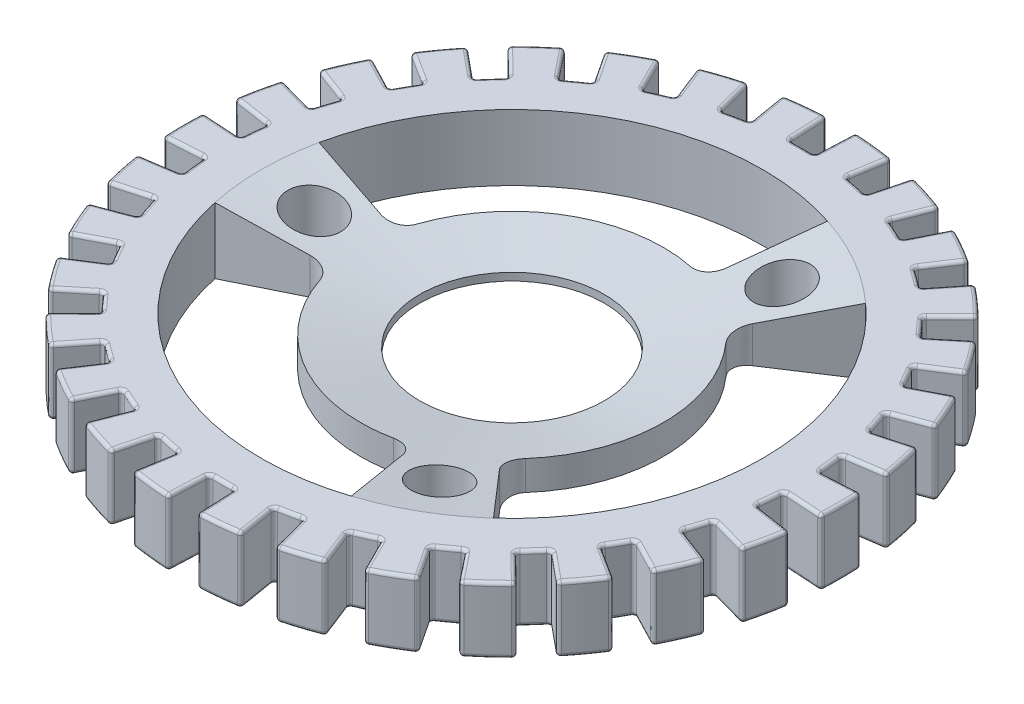
from build123d import *

# Parameters (mm, degrees)
SKETCH_1_W                       = 50
SKETCH_1_H                       = 10
SKETCH_2_W                       = 14
SKETCH_2_H                       = 10
CUT_REVOLVE_START                = -5
CUT_REVOLVE_2_DEPTH              = 10
PATTERN_CIRCULAR_1_COUNT         = 3
CUT_REVOLVE_3_DEPTH              = 10
FILLET_1_R                       = 0.5
PATTERN_CIRCULAR_2_COUNT         = 30
FILLET_1_OF_PATTERN_CIRCULAR_2_R = 0.5
FILLET_2_R                       = 0.5
SKETCH_7_W                       = 4
SKETCH_7_H                       = 20
PATTERN_CIRCULAR_3_COUNT         = 18
FILLET_5_R                       = 3


# Read off the part's stored shape, not the designer's step: Вырез-Повернуть2, Вырез-Повернуть3
with BuildPart() as part:
    # Эскиз1 → Повернуть1 (revolve)
    with BuildSketch(Plane.XY, mode=Mode.PRIVATE) as revolve_1_sk:
        with Locations((25, 0)):
            Rectangle(SKETCH_1_W, SKETCH_1_H)
    revolve(revolve_1_sk.sketch.rotate(Axis((0, -5, 0), (0, 1, 0)), 90), axis=Axis((0, -5, 0), (0, 1, 0)))

    # Эскиз2 → Вырез-Повернуть1 (revolve, cut)
    with BuildSketch(Plane.XY, mode=Mode.PRIVATE) as cut_revolve_1_sk:
        with Locations((7, 0)):
            Rectangle(SKETCH_2_W, SKETCH_2_H)
    revolve(cut_revolve_1_sk.sketch.rotate(Axis((0, 5, 0), (0, -1, 0)), 90), axis=Axis((0, 5, 0), (0, -1, 0)), mode=Mode.SUBTRACT)

    # Вырез-Повернуть2 outline → Вырез-Повернуть2 (cut)
    with BuildSketch(Plane(origin=(0, 0, 0), x_dir=(1, 0, 0), z_dir=(0, 1, 0)).offset(CUT_REVOLVE_START)):
        with BuildLine():
            ThreePointArc((15.390003946, 17.092330986), (23, 0), (15.390003946, -17.092330986))
            Line((15.390003946, -17.092330986), (25.426963042, -28.239503368))
            ThreePointArc((25.426963042, -28.239503368), (38, 0), (25.426963042, 28.239503368))
            Line((25.426963042, 28.239503368), (15.390003946, 17.092330986))
        make_face()
    cut_revolve_2 = extrude(amount=CUT_REVOLVE_2_DEPTH, mode=Mode.SUBTRACT)

    # Круговой массив1: Вырез-Повернуть2 ×3 about axis
    pattern_circular_1_axis = Axis((0, 0, 0), (0, 1, 0))
    for i in range(1, PATTERN_CIRCULAR_1_COUNT):
        add(cut_revolve_2.rotate(pattern_circular_1_axis, i * 360 / PATTERN_CIRCULAR_1_COUNT), mode=Mode.SUBTRACT)

    # Вырез-Повернуть3 outline → Вырез-Повернуть3 (cut)
    with BuildSketch(Plane(origin=(0, 0, 0), x_dir=(1, 0, 0), z_dir=(0, 1, 0)).offset(CUT_REVOLVE_START)):
        with BuildLine():
            ThreePointArc((-1.919253044, 43.95812175), (0, 44), (1.919253044, 43.95812175))
            Line((1.919253044, 43.95812175), (2.180969368, 49.952411079))
            ThreePointArc((2.180969368, 49.952411079), (0, 50), (-2.180969368, 49.952411079))
            Line((-2.180969368, 49.952411079), (-1.919253044, 43.95812175))
        make_face()
    cut_revolve_3 = extrude(amount=CUT_REVOLVE_3_DEPTH, mode=Mode.SUBTRACT)

    # Скругление1
    fillet_1_edges = [part.edges().sort_by_distance(p)[0] for p in [
        (-2.180969368, 0, -49.952411079),
        (-1.919253044, 0, -43.95812175),
        (2.180969368, 0, -49.952411079),
        (1.919253044, 0, -43.95812175),
    ]]
    fillet(fillet_1_edges, radius=FILLET_1_R)

    # Круговой массив2: Вырез-Повернуть3 ×30 about axis
    pattern_circular_2_axis = Axis((0, 0, 0), (0, 1, 0))
    for i in range(1, PATTERN_CIRCULAR_2_COUNT):
        add(cut_revolve_3.rotate(pattern_circular_2_axis, i * 360 / PATTERN_CIRCULAR_2_COUNT), mode=Mode.SUBTRACT)

    # Скругление1 of Круговой массив2
    fillet_1_of_pattern_circular_2_edges = [part.edges().sort_by_distance(p)[0] for p in [
        (-12.519000202, 0, -48.407382019),
        (-11.016720178, 0, -42.598496177),
        (-8.252380293, 0, -49.314280077),
        (-7.262094658, 0, -43.396566468),
        (-22.309890655, 0, -44.74671808),
        (-19.632703777, 0, -39.377111911),
        (-18.325061336, 0, -46.520878399),
        (-16.126053976, 0, -40.938372992),
        (-31.125731832, 0, -39.130407843),
        (-27.390644012, 0, -34.434758902),
        (-27.596849266, 0, -41.694291103),
        (-24.285227354, 0, -36.690976171),
        (-38.581229169, 0, -31.803911014),
        (-33.951481669, 0, -27.987441693),
        (-35.662522458, 0, -35.045463215),
        (-31.383019763, 0, -30.840007629),
        (-44.350541659, 0, -23.087430662),
        (-39.02847666, 0, -20.316938983),
        (-42.169572291, 0, -26.864980417),
        (-37.109223616, 0, -23.641182767),
        (-48.18152266, 0, -13.361918804),
        (-42.399739942, 0, -11.758488548),
        (-46.833609462, 0, -17.510369063),
        (-41.213576327, 0, -15.409124775),
        (-49.906739921, 0, -3.052426977),
        (-43.917931131, 0, -2.68613574),
        (-49.450793168, 0, -7.390470556),
        (-43.516697988, 0, -6.50361409),
        (-49.450793168, 0, 7.390470556),
        (-43.516697988, 0, 6.50361409),
        (-49.906739921, 0, 3.052426977),
        (-43.917931131, 0, 2.68613574),
        (-46.833609462, 0, 17.510369063),
        (-41.213576327, 0, 15.409124775),
        (-48.18152266, 0, 13.361918804),
        (-42.399739942, 0, 11.758488548),
        (-42.169572291, 0, 26.864980417),
        (-37.109223616, 0, 23.641182767),
        (-44.350541659, 0, 23.087430662),
        (-39.02847666, 0, 20.316938983),
        (-35.662522458, 0, 35.045463215),
        (-31.383019763, 0, 30.840007629),
        (-38.581229169, 0, 31.803911014),
        (-33.951481669, 0, 27.987441693),
        (-27.596849266, 0, 41.694291103),
        (-24.285227354, 0, 36.690976171),
        (-31.125731832, 0, 39.130407843),
        (-27.390644012, 0, 34.434758902),
        (-18.325061336, 0, 46.520878399),
        (-16.126053976, 0, 40.938372992),
        (-22.309890655, 0, 44.74671808),
        (-19.632703777, 0, 39.377111911),
        (-8.252380293, 0, 49.314280077),
        (-7.262094658, 0, 43.396566468),
        (-12.519000202, 0, 48.407382019),
        (-11.016720178, 0, 42.598496177),
        (2.180969368, 0, 49.952411079),
        (1.919253044, 0, 43.95812175),
        (-2.180969368, 0, 49.952411079),
        (-1.919253044, 0, 43.95812175),
        (12.519000202, 0, 48.407382019),
        (11.016720178, 0, 42.598496177),
        (8.252380293, 0, 49.314280077),
        (7.262094658, 0, 43.396566468),
        (22.309890655, 0, 44.74671808),
        (19.632703777, 0, 39.377111911),
        (18.325061336, 0, 46.520878399),
        (16.126053976, 0, 40.938372992),
        (31.125731832, 0, 39.130407843),
        (27.390644012, 0, 34.434758902),
        (27.596849266, 0, 41.694291103),
        (24.285227354, 0, 36.690976171),
        (38.581229169, 0, 31.803911014),
        (33.951481669, 0, 27.987441693),
        (35.662522458, 0, 35.045463215),
        (31.383019763, 0, 30.840007629),
        (44.350541659, 0, 23.087430662),
        (39.02847666, 0, 20.316938983),
        (42.169572291, 0, 26.864980417),
        (37.109223616, 0, 23.641182767),
        (48.18152266, 0, 13.361918804),
        (42.399739942, 0, 11.758488548),
        (46.833609462, 0, 17.510369063),
        (41.213576327, 0, 15.409124775),
        (49.906739921, 0, 3.052426977),
        (43.917931131, 0, 2.68613574),
        (49.450793168, 0, 7.390470556),
        (43.516697988, 0, 6.50361409),
        (49.450793168, 0, -7.390470556),
        (43.516697988, 0, -6.50361409),
        (49.906739921, 0, -3.052426977),
        (43.917931131, 0, -2.68613574),
        (46.833609462, 0, -17.510369063),
        (41.213576327, 0, -15.409124775),
        (48.18152266, 0, -13.361918804),
        (42.399739942, 0, -11.758488548),
        (42.169572291, 0, -26.864980417),
        (37.109223616, 0, -23.641182767),
        (44.350541659, 0, -23.087430662),
        (39.02847666, 0, -20.316938983),
        (35.662522458, 0, -35.045463215),
        (31.383019763, 0, -30.840007629),
        (38.581229169, 0, -31.803911014),
        (33.951481669, 0, -27.987441693),
        (27.596849266, 0, -41.694291103),
        (24.285227354, 0, -36.690976171),
        (31.125731832, 0, -39.130407843),
        (27.390644012, 0, -34.434758902),
        (18.325061336, 0, -46.520878399),
        (16.126053976, 0, -40.938372992),
        (22.309890655, 0, -44.74671808),
        (19.632703777, 0, -39.377111911),
        (8.252380293, 0, -49.314280077),
        (7.262094658, 0, -43.396566468),
        (12.519000202, 0, -48.407382019),
        (11.016720178, 0, -42.598496177),
    ]]
    fillet(fillet_1_of_pattern_circular_2_edges, radius=FILLET_1_OF_PATTERN_CIRCULAR_2_R)

    # Скругление2
    fillet_2_edges = [part.edges().sort_by_distance(p)[0] for p in [
        (-46.481107678, -5, -6.946648086),
        (-46.481107678, 5, -6.946648086),
        (-46.909673304, 5, -2.86911853),
        (-46.909673304, -5, -2.86911853),
        (-48.907380037, -5, -10.395584541),
        (-48.907380037, 5, -10.395584541),
        (-43.682081193, -5, -6.382260416),
        (-43.682081193, 5, -6.382260416),
        (-44.054469468, -5, -2.839222646),
        (-44.054469468, 5, -2.839222646),
        (-41.846486717, 5, -13.596747752),
        (-41.846486717, -5, -13.596747752),
        (-44.021094605, -5, -16.458812847),
        (-44.021094605, 5, -16.458812847),
        (-45.288061108, 5, -12.559490898),
        (-45.288061108, -5, -12.559490898),
        (-45.677272882, -5, -20.336832154),
        (-45.677272882, 5, -20.336832154),
        (-41.40057636, -5, -15.324808072),
        (-41.40057636, 5, -15.324808072),
        (-42.501466031, -5, -11.936618055),
        (-42.501466031, 5, -11.936618055),
        (-38.105117767, 5, -22),
        (-38.105117767, -5, -22),
        (-39.637148462, -5, -25.251648508),
        (-39.637148462, 5, -25.251648508),
        (-41.687143327, 5, -21.700953248),
        (-41.687143327, -5, -21.700953248),
        (-40.450849719, -5, -29.389262615),
        (-40.450849719, 5, -29.389262615),
        (-37.309667677, -5, -23.597588079),
        (-37.309667677, 5, -23.597588079),
        (-39.090944583, -5, -20.512325976),
        (-39.090944583, 5, -20.512325976),
        (-32.698372321, 5, -29.44174668),
        (-32.698372321, -5, -29.44174668),
        (-33.520868731, -5, -32.940865959),
        (-33.520868731, 5, -32.940865959),
        (-36.264297344, 5, -29.893979807),
        (-36.264297344, -5, -29.893979807),
        (-33.456530318, -5, -37.157241274),
        (-33.456530318, 5, -37.157241274),
        (-31.588147486, -5, -30.839040254),
        (-31.588147486, 5, -30.839040254),
        (-33.971961278, -5, -28.191546823),
        (-33.971961278, 5, -28.191546823),
        (-25.862551101, 5, -35.596747752),
        (-25.862551101, -5, -35.596747752),
        (-25.939566185, -5, -39.190409499),
        (-25.939566185, 5, -39.190409499),
        (-29.256527553, 5, -36.780496002),
        (-29.256527553, -5, -36.780496002),
        (-25, -5, -43.301270189),
        (-25, 5, -43.301270189),
        (-24.486073673, -5, -36.732678387),
        (-24.486073673, 5, -36.732678387),
        (-27.36824025, -5, -34.638661795),
        (-27.36824025, 5, -34.638661795),
        (-17.896412295, 5, -40.196000136),
        (-17.896412295, -5, -40.196000136),
        (-17.224580125, -5, -43.727144088),
        (-17.224580125, 5, -43.727144088),
        (-20.970107119, 5, -42.059528029),
        (-20.970107119, -5, -42.059528029),
        (-15.450849719, -5, -47.552825815),
        (-15.450849719, 5, -47.552825815),
        (-16.313840943, -5, -41.020922211),
        (-16.313840943, 5, -41.020922211),
        (-19.568395795, -5, -39.571901033),
        (-19.568395795, 5, -39.571901033),
        (-9.148114396, 5, -43.038494432),
        (-9.148114396, -5, -43.038494432),
        (-7.756797261, -5, -46.352792654),
        (-7.756797261, 5, -46.352792654),
        (-11.767192378, 5, -45.500356857),
        (-11.767192378, -5, -45.500356857),
        (-5.226423163, -5, -49.726094768),
        (-5.226423163, 5, -49.726094768),
        (-7.428615081, -5, -43.516354895),
        (-7.428615081, 5, -43.516354895),
        (-10.913318545, -5, -42.775658308),
        (-10.913318545, 5, -42.775658308),
        (9.148114396, 5, -43.038494432),
        (9.148114396, -5, -43.038494432),
        (11.767192378, -5, -45.500356857),
        (11.767192378, 5, -45.500356857),
        (7.756797261, 5, -46.352792654),
        (7.756797261, -5, -46.352792654),
        (15.450849719, -5, -47.552825815),
        (15.450849719, 5, -47.552825815),
        (10.913318545, -5, -42.775658308),
        (10.913318545, 5, -42.775658308),
        (7.428615081, -5, -43.516354895),
        (7.428615081, 5, -43.516354895),
        (17.896412295, 5, -40.196000136),
        (17.896412295, -5, -40.196000136),
        (20.970107119, -5, -42.059528029),
        (20.970107119, 5, -42.059528029),
        (17.224580125, 5, -43.727144088),
        (17.224580125, -5, -43.727144088),
        (25, -5, -43.301270189),
        (25, 5, -43.301270189),
        (19.568395795, -5, -39.571901033),
        (19.568395795, 5, -39.571901033),
        (16.313840943, -5, -41.020922211),
        (16.313840943, 5, -41.020922211),
        (25.862551101, 5, -35.596747752),
        (25.862551101, -5, -35.596747752),
        (29.256527553, -5, -36.780496002),
        (29.256527553, 5, -36.780496002),
        (25.939566185, 5, -39.190409499),
        (25.939566185, -5, -39.190409499),
        (33.456530318, -5, -37.157241274),
        (33.456530318, 5, -37.157241274),
        (27.36824025, -5, -34.638661795),
        (27.36824025, 5, -34.638661795),
        (24.486073673, -5, -36.732678387),
        (24.486073673, 5, -36.732678387),
        (32.698372321, 5, -29.44174668),
        (32.698372321, -5, -29.44174668),
        (36.264297344, -5, -29.893979807),
        (36.264297344, 5, -29.893979807),
        (33.520868731, 5, -32.940865959),
        (33.520868731, -5, -32.940865959),
        (40.450849719, -5, -29.389262615),
        (40.450849719, 5, -29.389262615),
        (33.971961278, -5, -28.191546823),
        (33.971961278, 5, -28.191546823),
        (31.588147486, -5, -30.839040254),
        (31.588147486, 5, -30.839040254),
        (38.105117767, 5, -22),
        (38.105117767, -5, -22),
        (41.687143327, -5, -21.700953248),
        (41.687143327, 5, -21.700953248),
        (39.637148462, 5, -25.251648508),
        (39.637148462, -5, -25.251648508),
        (45.677272882, -5, -20.336832154),
        (45.677272882, 5, -20.336832154),
        (39.090944583, -5, -20.512325976),
        (39.090944583, 5, -20.512325976),
        (37.309667677, -5, -23.597588079),
        (37.309667677, 5, -23.597588079),
        (41.846486717, 5, -13.596747752),
        (41.846486717, -5, -13.596747752),
        (45.288061108, -5, -12.559490898),
        (45.288061108, 5, -12.559490898),
        (44.021094605, 5, -16.458812847),
        (44.021094605, -5, -16.458812847),
        (48.907380037, -5, -10.395584541),
        (48.907380037, 5, -10.395584541),
        (42.501466031, -5, -11.936618055),
        (42.501466031, 5, -11.936618055),
        (41.40057636, -5, -15.324808072),
        (41.40057636, 5, -15.324808072),
        (43.758963396, 5, -4.599252384),
        (43.758963396, -5, -4.599252384),
        (46.909673304, -5, -2.86911853),
        (46.909673304, 5, -2.86911853),
        (46.481107678, 5, -6.946648086),
        (46.481107678, -5, -6.946648086),
        (50, -5, 0),
        (50, 5, 0),
        (44.054469468, -5, -2.839222646),
        (44.054469468, 5, -2.839222646),
        (43.682081193, -5, -6.382260416),
        (43.682081193, 5, -6.382260416),
        (43.758963396, 5, 4.599252384),
        (43.758963396, -5, 4.599252384),
        (46.481107678, -5, 6.946648086),
        (46.481107678, 5, 6.946648086),
        (46.909673304, 5, 2.86911853),
        (46.909673304, -5, 2.86911853),
        (48.907380037, -5, 10.395584541),
        (48.907380037, 5, 10.395584541),
        (43.682081193, -5, 6.382260416),
        (43.682081193, 5, 6.382260416),
        (44.054469468, -5, 2.839222646),
        (44.054469468, 5, 2.839222646),
        (41.846486717, 5, 13.596747752),
        (41.846486717, -5, 13.596747752),
        (0, 5, -44),
        (44.021094605, -5, 16.458812847),
        (44.021094605, 5, 16.458812847),
        (45.288061108, 5, 12.559490898),
        (45.288061108, -5, 12.559490898),
        (45.677272882, -5, 20.336832154),
        (45.677272882, 5, 20.336832154),
        (0, -5, -44),
        (41.40057636, -5, 15.324808072),
        (41.40057636, 5, 15.324808072),
        (42.501466031, -5, 11.936618055),
        (42.501466031, 5, 11.936618055),
        (2.049994864, -5, -46.952601756),
        (38.105117767, 5, 22),
        (38.105117767, -5, 22),
        (39.637148462, -5, 25.251648508),
        (39.637148462, 5, 25.251648508),
        (41.687143327, 5, 21.700953248),
        (41.687143327, -5, 21.700953248),
        (2.049994864, 5, -46.952601756),
        (40.450849719, -5, 29.389262615),
        (40.450849719, 5, 29.389262615),
        (37.309667677, -5, 23.597588079),
        (37.309667677, 5, 23.597588079),
        (39.090944583, -5, 20.512325976),
        (39.090944583, 5, 20.512325976),
        (-2.049994864, 5, -46.952601756),
        (32.698372321, 5, 29.44174668),
        (32.698372321, -5, 29.44174668),
        (33.520868731, -5, 32.940865959),
        (33.520868731, 5, 32.940865959),
        (-2.049994864, -5, -46.952601756),
        (36.264297344, 5, 29.893979807),
        (36.264297344, -5, 29.893979807),
        (33.456530318, -5, 37.157241274),
        (33.456530318, 5, 37.157241274),
        (31.588147486, -5, 30.839040254),
        (31.588147486, 5, 30.839040254),
        (33.971961278, -5, 28.191546823),
        (33.971961278, 5, 28.191546823),
        (5.226423163, -5, -49.726094768),
        (25.862551101, 5, 35.596747752),
        (25.862551101, -5, 35.596747752),
        (5.226423163, 5, -49.726094768),
        (25.939566185, -5, 39.190409499),
        (25.939566185, 5, 39.190409499),
        (29.256527553, 5, 36.780496002),
        (29.256527553, -5, 36.780496002),
        (25, -5, 43.301270189),
        (25, 5, 43.301270189),
        (24.486073673, -5, 36.732678387),
        (24.486073673, 5, 36.732678387),
        (27.36824025, -5, 34.638661795),
        (27.36824025, 5, 34.638661795),
        (17.896412295, 5, 40.196000136),
        (17.896412295, -5, 40.196000136),
        (17.224580125, -5, 43.727144088),
        (17.224580125, 5, 43.727144088),
        (20.970107119, 5, 42.059528029),
        (20.970107119, -5, 42.059528029),
        (15.450849719, -5, 47.552825815),
        (15.450849719, 5, 47.552825815),
        (16.313840943, -5, 41.020922211),
        (16.313840943, 5, 41.020922211),
        (19.568395795, -5, 39.571901033),
        (19.568395795, 5, 39.571901033),
        (1.781276906, -5, -44.109914055),
        (1.781276906, 5, -44.109914055),
        (-1.781276906, -5, -44.109914055),
        (9.148114396, 5, 43.038494432),
        (9.148114396, -5, 43.038494432),
        (-1.781276906, 5, -44.109914055),
        (7.756797261, -5, 46.352792654),
        (7.756797261, 5, 46.352792654),
        (11.767192378, 5, 45.500356857),
        (11.767192378, -5, 45.500356857),
        (5.226423163, -5, 49.726094768),
        (5.226423163, 5, 49.726094768),
        (7.428615081, -5, 43.516354895),
        (7.428615081, 5, 43.516354895),
        (10.913318545, -5, 42.775658308),
        (10.913318545, 5, 42.775658308),
        (0, 5, 44),
        (0, -5, 44),
        (-2.049994864, -5, 46.952601756),
        (-2.049994864, 5, 46.952601756),
        (2.049994864, 5, 46.952601756),
        (2.049994864, -5, 46.952601756),
        (-5.226423163, -5, 49.726094768),
        (-5.226423163, 5, 49.726094768),
        (-1.781276906, -5, 44.109914055),
        (-1.781276906, 5, 44.109914055),
        (1.781276906, -5, 44.109914055),
        (1.781276906, 5, 44.109914055),
        (-9.148114396, 5, 43.038494432),
        (-9.148114396, -5, 43.038494432),
        (-11.767192378, -5, 45.500356857),
        (-11.767192378, 5, 45.500356857),
        (-7.756797261, 5, 46.352792654),
        (-7.756797261, -5, 46.352792654),
        (-15.450849719, -5, 47.552825815),
        (-15.450849719, 5, 47.552825815),
        (-10.913318545, -5, 42.775658308),
        (-10.913318545, 5, 42.775658308),
        (-7.428615081, -5, 43.516354895),
        (-7.428615081, 5, 43.516354895),
        (-17.896412295, 5, 40.196000136),
        (-17.896412295, -5, 40.196000136),
        (-20.970107119, -5, 42.059528029),
        (-20.970107119, 5, 42.059528029),
        (-17.224580125, 5, 43.727144088),
        (-17.224580125, -5, 43.727144088),
        (-25, -5, 43.301270189),
        (-25, 5, 43.301270189),
        (-19.568395795, -5, 39.571901033),
        (-19.568395795, 5, 39.571901033),
        (-16.313840943, -5, 41.020922211),
        (-16.313840943, 5, 41.020922211),
        (-25.862551101, 5, 35.596747752),
        (-25.862551101, -5, 35.596747752),
        (-29.256527553, -5, 36.780496002),
        (-29.256527553, 5, 36.780496002),
        (-25.939566185, 5, 39.190409499),
        (-25.939566185, -5, 39.190409499),
        (-33.456530318, -5, 37.157241274),
        (-33.456530318, 5, 37.157241274),
        (-27.36824025, -5, 34.638661795),
        (-27.36824025, 5, 34.638661795),
        (-24.486073673, -5, 36.732678387),
        (-24.486073673, 5, 36.732678387),
        (-32.698372321, 5, 29.44174668),
        (-32.698372321, -5, 29.44174668),
        (-36.264297344, -5, 29.893979807),
        (-36.264297344, 5, 29.893979807),
        (-33.520868731, 5, 32.940865959),
        (-33.520868731, -5, 32.940865959),
        (-40.450849719, -5, 29.389262615),
        (-40.450849719, 5, 29.389262615),
        (-33.971961278, -5, 28.191546823),
        (-33.971961278, 5, 28.191546823),
        (-31.588147486, -5, 30.839040254),
        (-31.588147486, 5, 30.839040254),
        (-38.105117767, 5, 22),
        (-38.105117767, -5, 22),
        (-41.687143327, -5, 21.700953248),
        (-41.687143327, 5, 21.700953248),
        (-39.637148462, 5, 25.251648508),
        (-39.637148462, -5, 25.251648508),
        (-45.677272882, -5, 20.336832154),
        (-45.677272882, 5, 20.336832154),
        (-39.090944583, -5, 20.512325976),
        (-39.090944583, 5, 20.512325976),
        (-37.309667677, -5, 23.597588079),
        (-37.309667677, 5, 23.597588079),
        (-41.846486717, 5, 13.596747752),
        (-41.846486717, -5, 13.596747752),
        (-45.288061108, -5, 12.559490898),
        (-45.288061108, 5, 12.559490898),
        (-44.021094605, 5, 16.458812847),
        (-44.021094605, -5, 16.458812847),
        (-48.907380037, -5, 10.395584541),
        (-48.907380037, 5, 10.395584541),
        (-42.501466031, -5, 11.936618055),
        (-42.501466031, 5, 11.936618055),
        (-41.40057636, -5, 15.324808072),
        (-41.40057636, 5, 15.324808072),
        (-43.758963396, 5, 4.599252384),
        (-43.758963396, -5, 4.599252384),
        (-46.909673304, -5, 2.86911853),
        (-46.909673304, 5, 2.86911853),
        (-46.481107678, 5, 6.946648086),
        (-46.481107678, -5, 6.946648086),
        (-50, -5, 0),
        (-50, 5, 0),
        (-44.054469468, -5, 2.839222646),
        (-44.054469468, 5, 2.839222646),
        (-43.682081193, -5, 6.382260416),
        (-43.682081193, 5, 6.382260416),
        (-43.758963396, 5, -4.599252384),
        (-43.758963396, -5, -4.599252384),
    ]]
    fillet(fillet_2_edges, radius=FILLET_2_R)

    # Эскиз6 → Вырез-Повернуть4 (revolve, cut)
    with BuildSketch(Plane.XY, mode=Mode.PRIVATE) as cut_revolve_4_sk:
        Polygon((0, -2), (-38, 5), (0, 5), align=None)
    cut_revolve_4 = revolve(cut_revolve_4_sk.sketch.rotate(Axis((0, 0, 0), (0, 1, 0)), 90), axis=Axis((0, 0, 0), (0, 1, 0)), mode=Mode.SUBTRACT)

    # Зеркальное отражение1: Вырез-Повернуть4 across plane
    add(cut_revolve_4.mirror(Plane.ZX), mode=Mode.SUBTRACT)

    # Эскиз7 → Вырез-Повернуть5 (revolve, cut)
    with BuildSketch(Plane.XY, mode=Mode.PRIVATE) as cut_revolve_5_sk:
        with Locations((-32, 0)):
            Rectangle(SKETCH_7_W, SKETCH_7_H)
    cut_revolve_5 = revolve(cut_revolve_5_sk.sketch.rotate(Axis((-30, 10, 0), (0, -1, 0)), 45.291019183), axis=Axis((-30, 10, 0), (0, -1, 0)), mode=Mode.SUBTRACT)

    # Круговой массив3: Вырез-Повернуть5 ×18 about axis
    pattern_circular_3_axis = Axis((0, -5, 0), (0, -1, 0))
    for i in range(1, PATTERN_CIRCULAR_3_COUNT):
        add(cut_revolve_5.rotate(pattern_circular_3_axis, i * 360 / PATTERN_CIRCULAR_3_COUNT), mode=Mode.SUBTRACT)

    # Скругление5
    fillet_5_edges = [part.edges().sort_by_distance(p)[0] for p in [
        (-22.497394817, 0, -4.781968889),
        (7.107390871, 0, -21.874299875),
        (7.107390871, 0, 21.874299875),
        (-22.497394817, 0, 4.781968889),
        (15.390003946, 0, -17.092330986),
        (15.390003946, 0, 17.092330986),
    ]]
    fillet(fillet_5_edges, radius=FILLET_5_R)


solid = part.part
